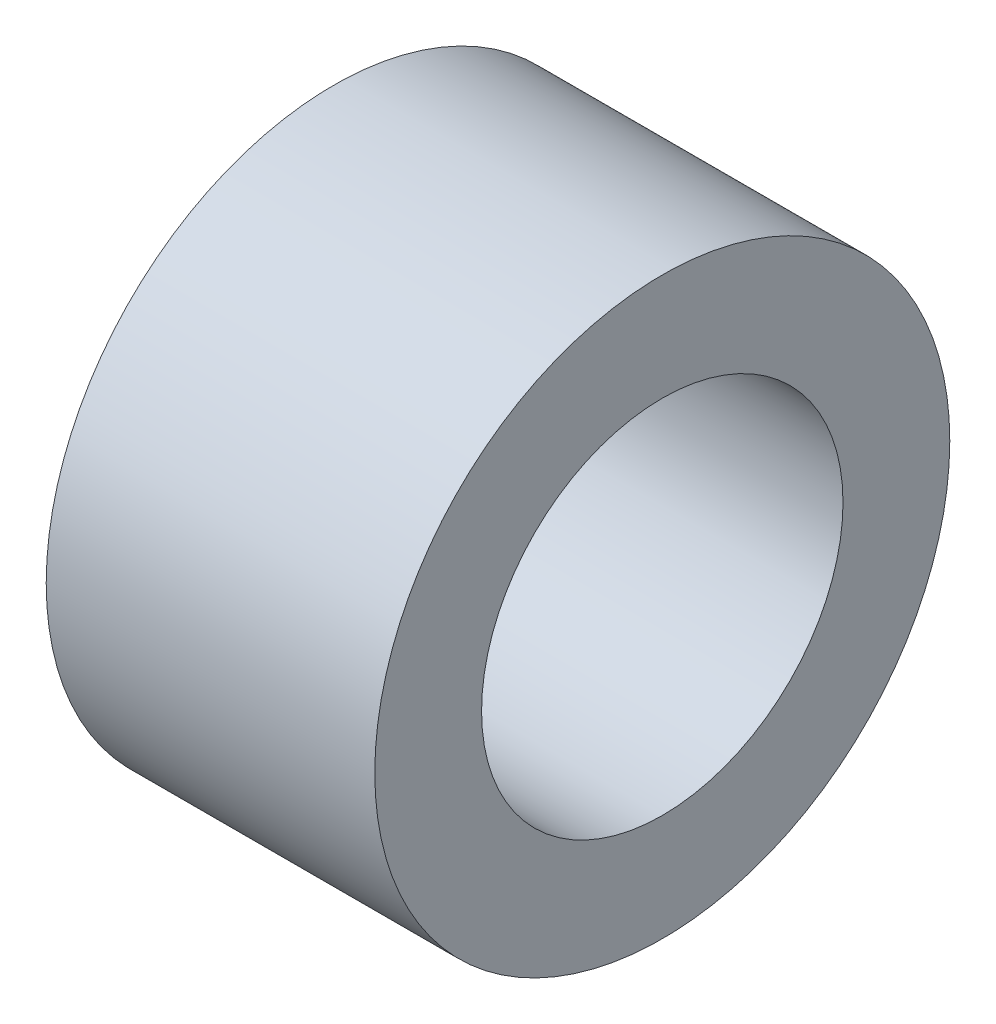
from build123d import *

# Parameters (mm, degrees)
SKETCH1_R           = 4.445
SKETCH1_R_2         = 2.794
BOSS_EXTRUDE1_DEPTH = 5.08


with BuildPart() as part:
    # Sketch1 → Boss-Extrude1 (new body)
    with BuildSketch(Plane(origin=(0, 0, 0), x_dir=(0, 0, -1), z_dir=(1, 0, 0))):
        Circle(SKETCH1_R)
        Circle(SKETCH1_R_2, mode=Mode.SUBTRACT)
    extrude(amount=BOSS_EXTRUDE1_DEPTH)


solid = part.part
